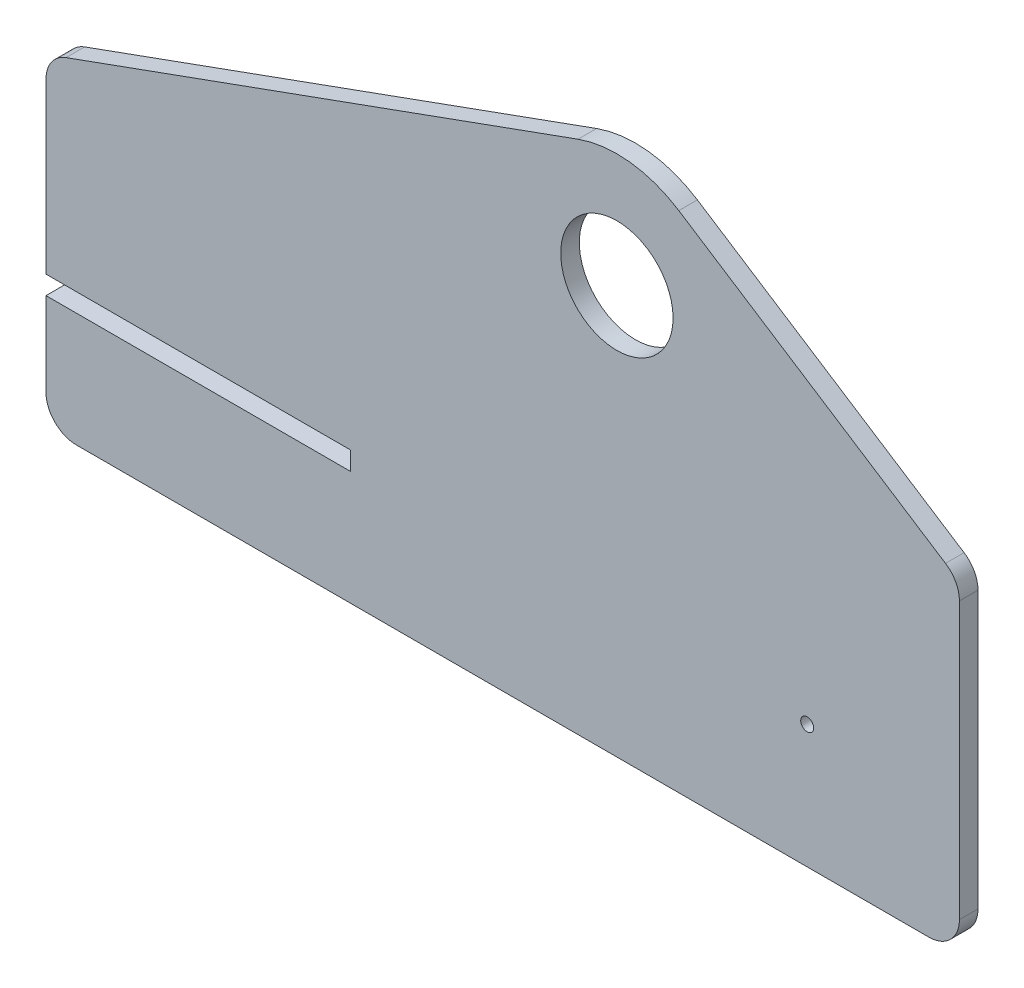
from build123d import *

# Parameters (mm, degrees)
BOSS_EXTRUDE1_DEPTH = 3.0988
SKETCH3_R           = 1.0795
SKETCH3_R_2         = 9.3726
BOSS_EXTRUDE2_DEPTH = 3.0988
FILLET1_R           = 5.08


with BuildPart() as part:
    # Sketch2 → Boss-Extrude1 (new body)
    with BuildSketch(Plane.XY):
        Polygon((-50.8, 1.5494), (-50.8, 7.8994), (50.8, 7.8994), (50.8, -7.8994), (-50.8, -7.8994), (-50.8, -1.5494), (0, -1.5494), (0, 1.5494), align=None)
    extrude(amount=BOSS_EXTRUDE1_DEPTH)

    # Sketch3 → Boss-Extrude2 (add)
    with BuildSketch(Plane.XY):
        with BuildLine():
            Line((50.8, -7.8994), (-50.8, -7.8994))
            Line((-50.8, -7.8994), (-50.8, -20.5994))
            Line((-50.8, -20.5994), (101.6, -20.5994))
            Line((101.6, -20.5994), (101.6, 33.2994))
            Line((101.6, 33.2994), (54.782161872, 63.523702231))
            ThreePointArc((54.782161872, 63.523702231), (46.597523005, 66.447615713), (37.96588061, 65.431577828))
            Line((37.96588061, 65.431577828), (-50.8, 33.2994))
            Line((-50.8, 33.2994), (-50.8, 7.8994))
            Line((-50.8, 7.8994), (50.8, 7.8994))
            Line((50.8, 7.8994), (50.8, -7.8994))
        make_face()
        with Locations((76.2, 0)):
            Circle(SKETCH3_R, mode=Mode.SUBTRACT)
        with Locations((44.45, 47.519048812)):
            Circle(SKETCH3_R_2, mode=Mode.SUBTRACT)
    extrude(amount=BOSS_EXTRUDE2_DEPTH)

    # Fillet1
    fillet1_edges = [part.edges().sort_by_distance(p)[0] for p in [
        (101.6, 33.2994, 1.5494),
        (101.6, -20.5994, 1.5494),
        (-50.8, -20.5994, 1.5494),
        (-50.8, 33.2994, 1.5494),
    ]]
    fillet(fillet1_edges, radius=FILLET1_R)


solid = part.part
